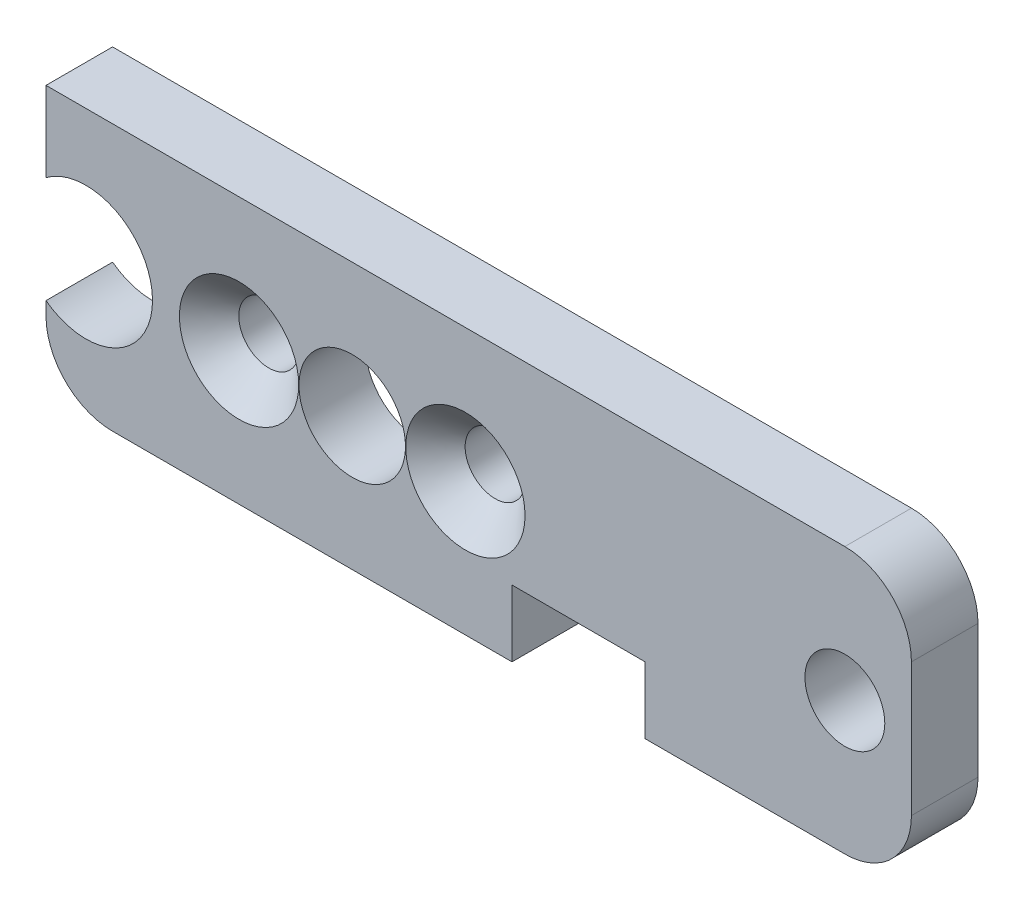
from build123d import *

# Parameters (mm, degrees)
SKETCH1_W                                            = 65
SKETCH1_H                                            = 20
BOSS_EXTRUDE1_DEPTH                                  = 5
F_10_0MM_DOWEL_HOLE1_D                               = 10
F_10_0MM_DOWEL_HOLE1_DEPTH                           = 25
F_10_0MM_DOWEL_HOLE1_TIP                             = 3.004303095
CSK_FOR_M4_HEX_SOCKET_COUNTERSUNK_CAP_SC_D           = 4.5
CSK_FOR_M4_HEX_SOCKET_COUNTERSUNK_CAP_SC_CSINK_D     = 8.96
CSK_FOR_M4_HEX_SOCKET_COUNTERSUNK_CAP_SC_CSINK_ANGLE = 90
F_6_0MM_DOWEL_HOLE1_D                                = 6
F_6_0MM_DOWEL_HOLE1_DEPTH                            = 25
F_6_0MM_DOWEL_HOLE1_TIP                              = 1.802581857
F_4_0MM_DOWEL_HOLE2_D                                = 4
F_4_0MM_DOWEL_HOLE2_DEPTH                            = 25
F_4_0MM_DOWEL_HOLE2_TIP                              = 1.201721238
F_8_0MM_DOWEL_HOLE1_D                                = 8
F_8_0MM_DOWEL_HOLE1_DEPTH                            = 5
F_8_0MM_DOWEL_HOLE1_TIP                              = 2.403442476
SKETCH22_W                                           = 10
SKETCH22_H                                           = 5
CUT_EXTRUDE1_DEPTH                                   = 10
M2_TAPPED_HOLE2_D                                    = 1.6
M2_TAPPED_HOLE2_DEPTH                                = 7
M2_TAPPED_HOLE2_TIP                                  = 0.480688495
FILLET1_R                                            = 5


with BuildPart() as part:
    # Sketch1 → Boss-Extrude1 (new body)
    with BuildSketch(Plane.XY):
        with Locations((5.197000354, -2.580625299)):
            Rectangle(SKETCH1_W, SKETCH1_H)
    extrude(amount=BOSS_EXTRUDE1_DEPTH)

    # Ø10.0mm Dowel Hole1
    with Locations(Plane(origin=(-24.302999646, -2.580625299, 5), x_dir=(1, 0, 0), z_dir=(0, 0, 1))):
        with Locations((0, 0)):
            Hole(F_10_0MM_DOWEL_HOLE1_D / 2, depth=F_10_0MM_DOWEL_HOLE1_DEPTH)
            with Locations((0, 0, -(F_10_0MM_DOWEL_HOLE1_DEPTH + F_10_0MM_DOWEL_HOLE1_TIP / 2))):  # 118° drill point
                Cone(0, F_10_0MM_DOWEL_HOLE1_D / 2, F_10_0MM_DOWEL_HOLE1_TIP, mode=Mode.SUBTRACT)

    # CSK for M4 Hex Socket Countersunk Cap Screw1 (through all)
    with Locations(Plane(origin=(-12.802999646, -2.580625299, 5), x_dir=(1, 0, 0), z_dir=(0, 0, 1))):
        with Locations((0, 0), (17, 0)):
            CounterSinkHole(CSK_FOR_M4_HEX_SOCKET_COUNTERSUNK_CAP_SC_D / 2, CSK_FOR_M4_HEX_SOCKET_COUNTERSUNK_CAP_SC_CSINK_D / 2, counter_sink_angle=CSK_FOR_M4_HEX_SOCKET_COUNTERSUNK_CAP_SC_CSINK_ANGLE)

    # Ø6.0mm Dowel Hole1
    with Locations(Plane(origin=(32.697000354, -2.580625299, 5), x_dir=(1, 0, 0), z_dir=(0, 0, 1))):
        with Locations((0, 0)):
            Hole(F_6_0MM_DOWEL_HOLE1_D / 2, depth=F_6_0MM_DOWEL_HOLE1_DEPTH)
            with Locations((0, 0, -(F_6_0MM_DOWEL_HOLE1_DEPTH + F_6_0MM_DOWEL_HOLE1_TIP / 2))):  # 118° drill point
                Cone(0, F_6_0MM_DOWEL_HOLE1_D / 2, F_6_0MM_DOWEL_HOLE1_TIP, mode=Mode.SUBTRACT)

    # Ø4.0mm Dowel Hole2
    with Locations(Plane(origin=(-4.302999646, -2.580625299, 0), x_dir=(-1, 0, 0), z_dir=(0, 0, -1))):
        with Locations((0, 0)):
            Hole(F_4_0MM_DOWEL_HOLE2_D / 2, depth=F_4_0MM_DOWEL_HOLE2_DEPTH)
            with Locations((0, 0, -(F_4_0MM_DOWEL_HOLE2_DEPTH + F_4_0MM_DOWEL_HOLE2_TIP / 2))):  # 118° drill point
                Cone(0, F_4_0MM_DOWEL_HOLE2_D / 2, F_4_0MM_DOWEL_HOLE2_TIP, mode=Mode.SUBTRACT)

    # Ø8.0mm Dowel Hole1
    with Locations(Plane(origin=(-4.302999646, -2.580625299, 0), x_dir=(-1, 0, 0), z_dir=(0, 0, -1))):
        with Locations((0, 0)):
            Hole(F_8_0MM_DOWEL_HOLE1_D / 2, depth=F_8_0MM_DOWEL_HOLE1_DEPTH)
            with Locations((0, 0, -(F_8_0MM_DOWEL_HOLE1_DEPTH + F_8_0MM_DOWEL_HOLE1_TIP / 2))):  # 118° drill point
                Cone(0, F_8_0MM_DOWEL_HOLE1_D / 2, F_8_0MM_DOWEL_HOLE1_TIP, mode=Mode.SUBTRACT)

    # Sketch22 → Cut-Extrude1 (cut)
    with BuildSketch(Plane(origin=(0, 0, 0), x_dir=(-1, 0, 0), z_dir=(0, 0, -1))):
        with Locations((-12.697000354, -10.080625299)):
            Rectangle(SKETCH22_W, SKETCH22_H)
    extrude(amount=-CUT_EXTRUDE1_DEPTH, mode=Mode.SUBTRACT)

    # M2 Tapped Hole2
    with Locations(Plane(origin=(12.697000354, -7.580625299, 2.5), x_dir=(-1, 0, 0), z_dir=(0, -1, 0))):
        with Locations((0, 0)):
            Hole(M2_TAPPED_HOLE2_D / 2, depth=M2_TAPPED_HOLE2_DEPTH)
            with Locations((0, 0, -(M2_TAPPED_HOLE2_DEPTH + M2_TAPPED_HOLE2_TIP / 2))):  # 118° drill point
                Cone(0, M2_TAPPED_HOLE2_D / 2, M2_TAPPED_HOLE2_TIP, mode=Mode.SUBTRACT)

    # Fillet1
    fillet1_edges = [part.edges().sort_by_distance(p)[0] for p in [
        (37.697000354, 7.419374701, 2.5),
        (37.697000354, -12.580625299, 2.5),
        (-27.302999646, -12.580625299, 2.5),
    ]]
    fillet(fillet1_edges, radius=FILLET1_R)


solid = part.part
